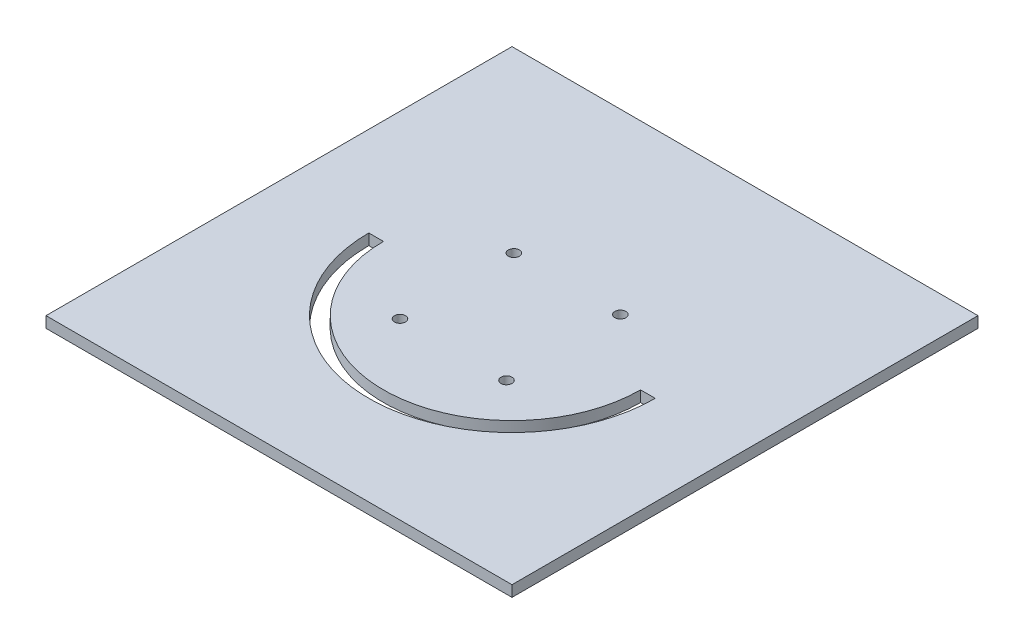
from build123d import *

# Parameters (mm, degrees)
SKETCH2_W           = 126.877068242
SKETCH2_H           = 126.877068242
SKETCH2_R           = 1.5
BOSS_EXTRUDE1_DEPTH = 3
CUT_EXTRUDE1_DEPTH  = 10


with BuildPart() as part:
    # Sketch2 → Boss-Extrude1 (new body)
    with BuildSketch(Plane(origin=(0, 0, 0), x_dir=(1, 0, 0), z_dir=(0, 1, 0))):
        Rectangle(SKETCH2_W, SKETCH2_H)
        with Locations((14.5, 15)):
            Circle(SKETCH2_R, mode=Mode.SUBTRACT)
        with Locations((-14.5, 15)):
            Circle(SKETCH2_R, mode=Mode.SUBTRACT)
        with Locations((-14.5, -16)):
            Circle(SKETCH2_R, mode=Mode.SUBTRACT)
        with Locations((14.5, -16)):
            Circle(SKETCH2_R, mode=Mode.SUBTRACT)
    extrude(amount=BOSS_EXTRUDE1_DEPTH)

    # Sketch3 → Cut-Extrude1 (cut)
    with BuildSketch(Plane(origin=(0, 3, 0), x_dir=(1, 0, 0), z_dir=(0, 1, 0))):
        with BuildLine():
            Line((-39, 0), (-35, 0))
            ThreePointArc((-35, 0), (0, -35), (35, 0))
            Line((35, 0), (39, 0))
            ThreePointArc((39, 0), (0, -39), (-39, 0))
        make_face()
    extrude(amount=-CUT_EXTRUDE1_DEPTH, mode=Mode.SUBTRACT)


solid = part.part
